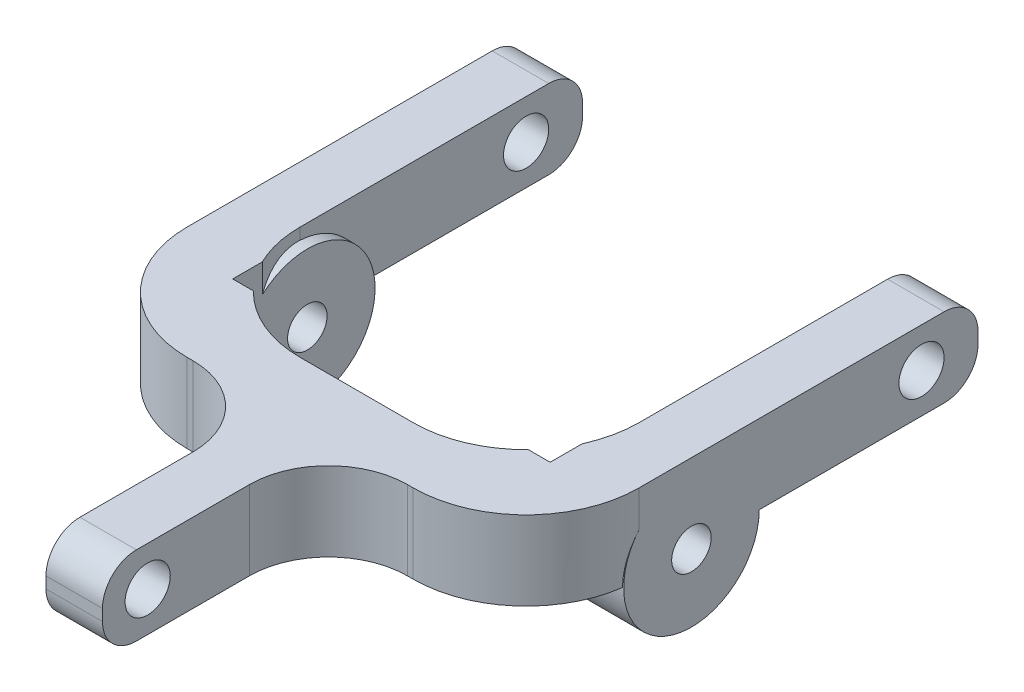
from build123d import *

# Parameters (mm, degrees)
SKETCH1_W               = 40
SKETCH1_H               = 7
BOSS_EXTRUDE1_DEPTH     = 40
CUT_EXTRUDE1_DEPTH      = 46.265881191
FILLET1_R               = 10
SKETCH5_W               = 5
SKETCH5_H               = 7
BOSS_EXTRUDE2_DEPTH     = 20
FILLET2_R               = 7
FILLET3_R               = 3
SKETCH6_R               = 2
CUT_EXTRUDE2_DEPTH      = 57.676714795
SKETCH7_R               = 2
CUT_EXTRUDE3_DEPTH      = 47.027165891
SKETCH8_R               = 6
BOSS_EXTRUDE3_DEPTH     = 40
CUT_EXTRUDE4_DEPTH      = 58.360700919
CUT_EXTRUDE4_DEPTH_BACK = 58.360700919
SKETCH9_W               = 28.10166571
SKETCH9_H               = 14.198736358
SKETCH10_R              = 1.75
CUT_EXTRUDE5_DEPTH      = 58.360700919


with BuildPart() as part:
    # Sketch1 → Boss-Extrude1 (new body)
    with BuildSketch(Plane(origin=(0, 0, 0), x_dir=(0, 0, -1), z_dir=(1, 0, 0))):
        Rectangle(SKETCH1_W, SKETCH1_H)
    extrude(amount=BOSS_EXTRUDE1_DEPTH)

    # Sketch2 → Cut-Extrude1 (cut, through all)
    with BuildSketch(Plane(origin=(0, 3.5, 0), x_dir=(1, 0, 0), z_dir=(0, 1, 0))):
        with BuildLine():
            Line((5, 20), (35, 20))
            Line((35, 20), (35, -5))
            ThreePointArc((35, -5), (32.071067812, -12.071067812), (25, -15))
            Line((25, -15), (15, -15))
            ThreePointArc((15, -15), (7.928932188, -12.071067812), (5, -5))
            Line((5, -5), (5, 20))
        make_face()
    extrude(amount=-CUT_EXTRUDE1_DEPTH, mode=Mode.SUBTRACT)

    # Fillet1
    fillet1_edges = [part.edges().sort_by_distance(p)[0] for p in [
        (40, 0, 20),
        (0, 0, 20),
    ]]
    fillet(fillet1_edges, radius=FILLET1_R)

    # Sketch5 → Boss-Extrude2 (add)
    with BuildSketch(Plane.XY.offset(20)):
        with Locations((20, 0)):
            Rectangle(SKETCH5_W, SKETCH5_H)
    extrude(amount=BOSS_EXTRUDE2_DEPTH)

    # Fillet2
    fillet2_edges = [part.edges().sort_by_distance(p)[0] for p in [
        (22.5, 0, 20),
        (17.5, 0, 20),
    ]]
    fillet(fillet2_edges, radius=FILLET2_R)

    # Fillet3
    fillet3_edges = [part.edges().sort_by_distance(p)[0] for p in [
        (2.5, -3.5, -20),
        (2.5, 3.5, -20),
        (37.5, -3.5, -20),
        (37.5, 3.5, -20),
        (20, -3.5, 40),
        (20, 3.5, 40),
    ]]
    fillet(fillet3_edges, radius=FILLET3_R)

    # Sketch6 → Cut-Extrude2 (cut, through all)
    with BuildSketch(Plane(origin=(40, 0, 0), x_dir=(0, 0, -1), z_dir=(1, 0, 0))):
        with Locations((15, 0)):
            Circle(SKETCH6_R)
    extrude(amount=-CUT_EXTRUDE2_DEPTH, mode=Mode.SUBTRACT)

    # Sketch7 → Cut-Extrude3 (cut, through all)
    with BuildSketch(Plane(origin=(22.5, 0, 0), x_dir=(0, 0, -1), z_dir=(1, 0, 0))):
        with Locations((-36, 0)):
            Circle(SKETCH7_R)
    extrude(amount=-CUT_EXTRUDE3_DEPTH, mode=Mode.SUBTRACT)

    # Sketch8 → Boss-Extrude3 (add)
    with BuildSketch(Plane(origin=(40, 0, 0), x_dir=(0, 0, -1), z_dir=(1, 0, 0))):
        with Locations((-5.366027913, -3.5)):
            Circle(SKETCH8_R)
    extrude(amount=-BOSS_EXTRUDE3_DEPTH)

    # Sketch9 → Cut-Extrude4 (cut, two sides: drawn at the far end of the back side and taken through both)
    with BuildSketch(Plane(origin=(0, 0, 0), x_dir=(1, 0, 0), z_dir=(0, 1, 0)).offset(-CUT_EXTRUDE4_DEPTH_BACK)):
        with Locations((20.049301168, -4.872678537)):
            Rectangle(SKETCH9_W, SKETCH9_H)
    extrude(amount=CUT_EXTRUDE4_DEPTH + CUT_EXTRUDE4_DEPTH_BACK, mode=Mode.SUBTRACT)

    # Sketch10 → Cut-Extrude5 (cut, through all)
    with BuildSketch(Plane(origin=(40, 0, 0), x_dir=(0, 0, -1), z_dir=(1, 0, 0))):
        with Locations((-5.366027913, -3.5)):
            Circle(SKETCH10_R)
    extrude(amount=-CUT_EXTRUDE5_DEPTH, mode=Mode.SUBTRACT)


solid = part.part
